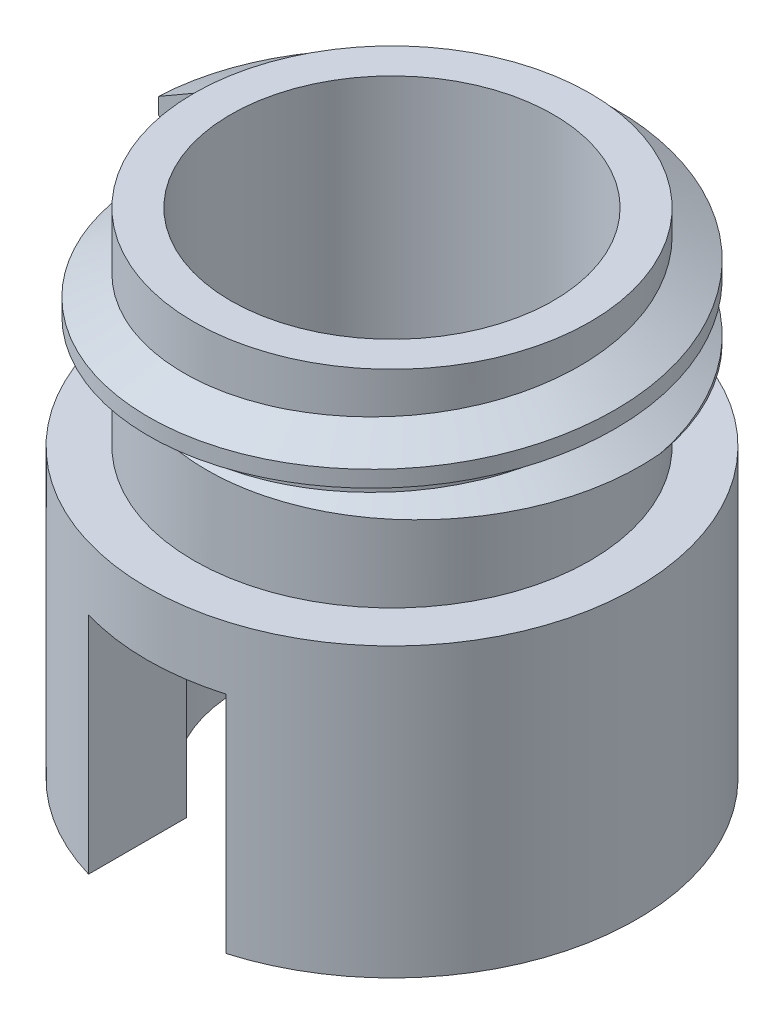
from build123d import *
from build123d.topology import SkipClean

# Parameters (mm, degrees)
SKETCH1_R               = 2.995
BOSS_EXTRUDE1_DEPTH     = 3.52
SKETCH2_R               = 2.425
SKETCH2_R_2             = 1.975
BOSS_EXTRUDE2_DEPTH     = 2.53
THREAD1_PITCH           = 0.8
SKETCH6_R               = 3.05
SKETCH6_R_2             = 2.425
CUT_EXTRUDE1_DEPTH      = 1.1
SKETCH7_R               = 1.875
CUT_EXTRUDE2_DEPTH      = 3
CUT_EXTRUDE4_DEPTH      = 8.385434789
CUT_EXTRUDE4_DEPTH_BACK = 8.385434789
SKETCH9_W               = 1.68
SKETCH9_H               = 2.75
CUT_EXTRUDE6_START      = -3.18
SKETCH10_R              = 1.975
CUT_EXTRUDE6_DEPTH      = 3.18


with BuildPart() as part:
    # Sketch1 → Boss-Extrude1 (new body)
    with BuildSketch(Plane(origin=(0, 0, 0), x_dir=(1, 0, 0), z_dir=(0, 1, 0))):
        with Locations(Location((0, 0, 0), (0, 0, 270))):
            Circle(SKETCH1_R)
    extrude(amount=BOSS_EXTRUDE1_DEPTH)

    # Sketch2 → Boss-Extrude2 (add)
    with BuildSketch(Plane(origin=(0, 3.52, 0), x_dir=(1, 0, 0), z_dir=(0, 1, 0))):
        with Locations(Location((0, 0, 0), (0, 0, 270))):
            Circle(SKETCH2_R)
        with Locations(Location((0, 0, 0), (0, 0, 270))):
            Circle(SKETCH2_R_2, mode=Mode.SUBTRACT)
    extrude(amount=BOSS_EXTRUDE2_DEPTH)

    # Thread1: the profile of Thread Profile1 profile screwed along a right-hand helix of 1.875 turns, 8 arcs to a turn; built about Z, then put on its axis
    thread1_z = Axis((0, 0, 0), (0, 0, 1))
    thread1_corners = [(2.4247, 0, -0.000173205), (2.4247, 0, 0.700173203), (2.8580127, 0, 0.449999999), (2.8580127, 0, 0.249999999)]
    with BuildLine(mode=Mode.PRIVATE) as thread1_profile:
        Line(thread1_corners[0], thread1_corners[1])
        Line(thread1_corners[1], thread1_corners[2])
        Line(thread1_corners[2], thread1_corners[3])
        Line(thread1_corners[3], thread1_corners[0])
    thread1_cap = Face(thread1_profile.wire())
    thread1_turn_angles = [0, 22.5, 45, 67.5, 90, 112.5, 135, 157.5, 180, 202.5, 225, 247.5, 270, 292.5, 315, 337.5, 360]
    thread1_turn_weights = [1, 0.9238795325112867, 1, 0.9238795325112867, 1, 0.9238795325112867, 1, 0.9238795325112867, 1, 0.9238795325112867, 1, 0.9238795325112867, 1, 0.9238795325112867, 1, 0.9238795325112867, 1]
    thread1_turn_rails = [Edge.make_bspline([Vector(p[0], p[1], 0).rotate(thread1_z, thread1_turn_angles[k]) / thread1_turn_weights[k] + Vector(0, 0, p[2] + THREAD1_PITCH * thread1_turn_angles[k] / 360) for k in range(17)], [0, 0, 0, 1, 1, 2, 2, 3, 3, 4, 4, 5, 5, 6, 6, 7, 7, 8, 8, 8], 2, thread1_turn_weights) for p in thread1_corners]
    thread1_turn_sides = [Face.make_surface_from_curves(thread1_turn_rails[p[0]], thread1_turn_rails[p[1]]) for p in [(0, 1), (1, 2), (2, 3), (3, 0)]]
    thread1_last_angles = [360, 382.5, 405, 427.5, 450, 472.5, 495, 517.5, 540, 562.5, 585, 607.5, 630, 652.5, 675]
    thread1_last_weights = [1, 0.9238795325112867, 1, 0.9238795325112867, 1, 0.9238795325112867, 1, 0.9238795325112867, 1, 0.9238795325112867, 1, 0.9238795325112867, 1, 0.9238795325112867, 1]
    thread1_last_rails = [Edge.make_bspline([Vector(p[0], p[1], 0).rotate(thread1_z, thread1_last_angles[k]) / thread1_last_weights[k] + Vector(0, 0, p[2] + THREAD1_PITCH * thread1_last_angles[k] / 360) for k in range(15)], [0, 0, 0, 1, 1, 2, 2, 3, 3, 4, 4, 5, 5, 6, 6, 7, 7, 7], 2, thread1_last_weights) for p in thread1_corners]
    thread1_last_sides = [Face.make_surface_from_curves(thread1_last_rails[p[0]], thread1_last_rails[p[1]]) for p in [(0, 1), (1, 2), (2, 3), (3, 0)]]
    thread1 = Plane(origin=(0, 6.05, 0), x_dir=(-1, 0, 0), z_dir=(0, -1, 0)) * Solid(Shell([*thread1_turn_sides, *thread1_last_sides, thread1_cap, thread1_cap.rotate(thread1_z, 675).moved(Location((0, 0, THREAD1_PITCH * 675 / 360)))]))
    add(thread1)

    # Sketch6 → Cut-Extrude1 (cut)
    with BuildSketch(Plane(origin=(0, 3.52, 0), x_dir=(1, 0, 0), z_dir=(0, 1, 0))):
        Circle(SKETCH6_R)
        with Locations(Location((0, 0, 0), (0, 0, 180))):
            Circle(SKETCH6_R_2, mode=Mode.SUBTRACT)
    extrude(amount=CUT_EXTRUDE1_DEPTH, mode=Mode.SUBTRACT)

    # Sketch7 → Cut-Extrude2 (cut)
    with BuildSketch(Plane.XZ):
        with Locations(Location((0, 0, 0), (0, 0, 270))):
            Circle(SKETCH7_R)
    extrude(amount=-CUT_EXTRUDE2_DEPTH, mode=Mode.SUBTRACT)

    # Sketch9 → Cut-Extrude4 (cut, two sides: drawn at the far end of the back side and taken through both)
    with BuildSketch(Plane.XY.offset(-CUT_EXTRUDE4_DEPTH_BACK)):
        with Locations((0, 1.375)):
            Rectangle(SKETCH9_W, SKETCH9_H)
    extrude(amount=CUT_EXTRUDE4_DEPTH + CUT_EXTRUDE4_DEPTH_BACK, mode=Mode.SUBTRACT)

    # Sketch10 → Cut-Extrude6 (cut)
    with SkipClean():  # the faces are left unmerged after this step: merging them gives an invalid solid
        with BuildSketch(Plane(origin=(0, 6.05, 0), x_dir=(1, 0, 0), z_dir=(0, 1, 0)).offset(CUT_EXTRUDE6_START)):
            with Locations(Location((0, 0, 0), (0, 0, 270))):
                Circle(SKETCH10_R)
        extrude(amount=CUT_EXTRUDE6_DEPTH, mode=Mode.SUBTRACT)


solid = part.part
